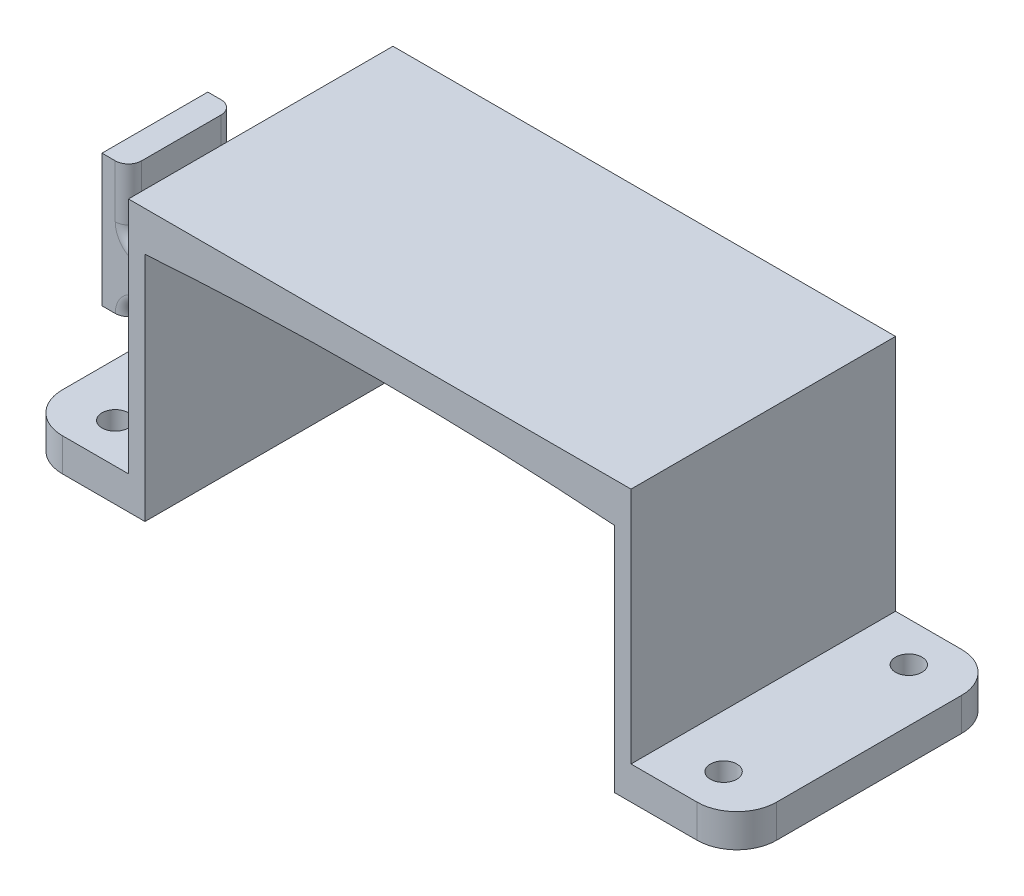
from build123d import *

# Parameters (mm, degrees)
BOSS_EXTRUDE1_DEPTH      = 20
SKETCH2_W                = 20
SKETCH2_H                = 2.5
BOSS_EXTRUDE2_DEPTH      = 8
SKETCH9_R                = 1
CORTE_EXTRUS_O1_DEPTH    = 39.118237105
FILETE1_R                = 3
ESBO_O8_W                = 0.75
ESBO_O8_H                = 17.5
CORTE_EXTRUS_O8_DEPTH    = 37.796738986
CORTE_EXTRUS_O9_DEPTH    = 37.796738986
FILETE1_OF_ESPELHAR1_R   = 3
ESBO_O14_W               = 8
ESBO_O14_H               = 4
RESSALTO_EXTRUS_O2_DEPTH = 6
ESBO_O15_W               = 8
ESBO_O15_H               = 10
RESSALTO_EXTRUS_O3_DEPTH = 2
FILETE3_R                = 1


with BuildPart() as part:
    # Sketch1 → Boss-Extrude1 (new body)
    with BuildSketch(Plane.XY):
        Polygon((17, -15), (19, -15), (19, 5.5), (-19, 5.5), (-19, -15), (-17, -15), (-17, 2.5), (17, 2.5), align=None)
    extrude(amount=BOSS_EXTRUDE1_DEPTH)

    # Sketch2 → Boss-Extrude2 (add)
    with BuildSketch(Plane(origin=(19, 0, 0), x_dir=(0, 0, -1), z_dir=(1, 0, 0))):
        with Locations((-10, -13.75)):
            Rectangle(SKETCH2_W, SKETCH2_H)
    boss_extrude2 = extrude(amount=BOSS_EXTRUDE2_DEPTH)

    # Sketch9 → Corte-extrusão1 (cut, through all)
    with BuildSketch(Plane(origin=(0, -12.5, 0), x_dir=(1, 0, 0), z_dir=(0, 1, 0))):
        with Locations(Location((23, -3, 0), (0, 0, 270))):
            Circle(SKETCH9_R)
        with Locations(Location((23, -17, 0), (0, 0, 270))):
            Circle(SKETCH9_R)
    corte_extrus_o1 = extrude(amount=-CORTE_EXTRUS_O1_DEPTH, mode=Mode.SUBTRACT)

    # Filete1
    filete1_edges = [part.edges().sort_by_distance(p)[0] for p in [
        (27, -13.75, 0),
        (27, -13.75, 20),
    ]]
    fillet(filete1_edges, radius=FILETE1_R)

    # Esboço8 → Corte-extrusão8 (cut, through all)
    with BuildSketch(Plane.XY.offset(20)):
        with Locations((17.375, -6.25)):
            Rectangle(ESBO_O8_W, ESBO_O8_H)
        with Locations((-17.375, -6.25)):
            Rectangle(ESBO_O8_W, ESBO_O8_H)
    extrude(amount=-CORTE_EXTRUS_O8_DEPTH, mode=Mode.SUBTRACT)

    # Esboço11 → Corte-extrusão9 (cut, through all)
    with BuildSketch(Plane.XY.offset(20)):
        with BuildLine():
            Line((-17.75, 2.5), (17.75, 2.5))
            add(Edge.make_bspline(
                [(-17.75, 2.5), (0, 3.750116691), (17.75, 2.5)],
                knots=[0, 0, 0, 1, 1, 1], degree=2))
        make_face()
    extrude(amount=-CORTE_EXTRUS_O9_DEPTH, mode=Mode.SUBTRACT)

    # Espelhar1: Boss-Extrude2, Corte-extrusão1 across plane
    add(boss_extrude2.mirror(Plane(origin=(0, 0, 0), x_dir=(0, 0, 1), z_dir=(1, 0, 0))))
    add(corte_extrus_o1.mirror(Plane(origin=(0, 0, 0), x_dir=(0, 0, 1), z_dir=(1, 0, 0))), mode=Mode.SUBTRACT)

    # Filete1 of Espelhar1
    filete1_of_espelhar1_edges = [part.edges().sort_by_distance(p)[0] for p in [
        (-27, -13.75, 0),
        (-27, -13.75, 20),
    ]]
    fillet(filete1_of_espelhar1_edges, radius=FILETE1_OF_ESPELHAR1_R)

    # Esboço14 → Ressalto-extrusão2 (add)
    with BuildSketch(Plane.ZY.offset(19)):
        with Locations((10, -5.5)):
            Rectangle(ESBO_O14_W, ESBO_O14_H)
    extrude(amount=RESSALTO_EXTRUS_O2_DEPTH)

    # Esboço15 → Ressalto-extrusão3 (add)
    with BuildSketch(Plane.ZY.offset(25)):
        with Locations((10, -3.5)):
            Rectangle(ESBO_O15_W, ESBO_O15_H)
    extrude(amount=RESSALTO_EXTRUS_O3_DEPTH)

    # Filete3
    filete3_edges = [part.edges().sort_by_distance(p)[0] for p in [
        (-19, -5.5, 6),
        (-22, -3.5, 6),
        (-19, -7.5, 10),
        (-22, -7.5, 6),
        (-19, -5.5, 14),
        (-22, -7.5, 14),
        (-19, -3.5, 10),
        (-22, -3.5, 14),
        (-25, -7.5, 10),
        (-25, -3.5, 10),
        (-25, -8, 14),
        (-25, -1, 14),
        (-25, -1, 6),
        (-25, -8, 6),
    ]]
    fillet(filete3_edges, radius=FILETE3_R - 0.0001)  # a hair under: the kernel refuses the full size


solid = part.part
